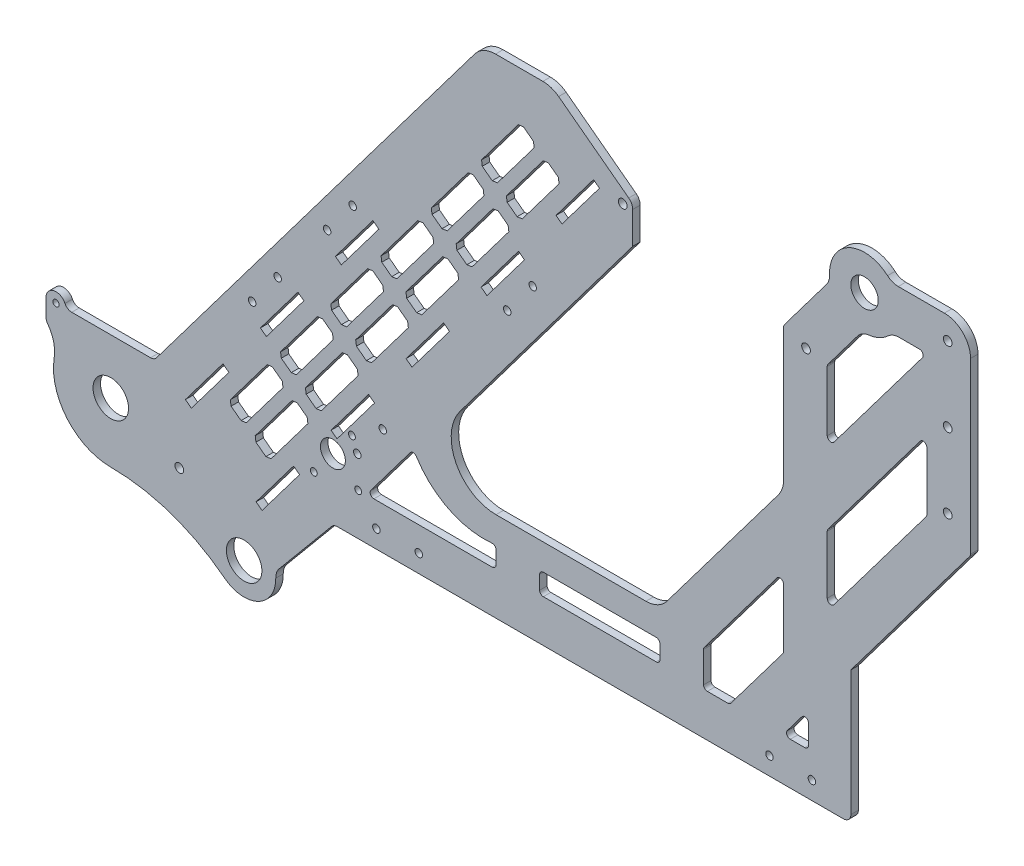
from build123d import *

# Parameters (mm, degrees)
ESBO_O1_R                 = 14.25
RESSALTO_EXTRUS_O1_DEPTH  = 6
RESSALTO_EXTRUS_O2_DEPTH  = 6
FILETE1_R                 = 12
FILETE2_R                 = 6
CORTE_EXTRUS_O1_DEPTH     = 10
FILETE3_R                 = 6
RESSALTO_EXTRUS_O3_DEPTH  = 6
ESBO_O6_R                 = 2.5
CORTE_EXTRUS_O2_DEPTH     = 10
FILETE4_R                 = 6
CORTE_EXTRUS_O3_DEPTH     = 864.46704654
ESBO_O8_R                 = 16
ESBO_O8_R_2               = 14.25
RESSALTO_EXTRUS_O4_DEPTH  = 6
CORTE_EXTRUS_O4_DEPTH     = 983.515139832
FILETE5_R                 = 55
CORTE_EXTRUS_O5_DEPTH     = 983.515139832
FILETE8_R                 = 21
RESSALTO_EXTRUS_O5_DEPTH  = 6
ESBO_O13_R                = 2.5
CORTE_EXTRUS_O7_DEPTH     = 983.515139832
CORTE_EXTRUS_O8_DEPTH     = 983.515139832
FILETE10_R                = 21
FILETE11_R                = 21
FILETE12_R                = 21
RESSALTO_EXTRUS_O6_DEPTH  = 6
FILETE13_R                = 21
CHANFRO1_SIZE             = 55
CHANFRO1_SIZE2            = 72.987465189
CORTE_EXTRUS_O10_DEPTH    = 983.515139832
FILETE15_R                = 3
RESSALTO_EXTRUS_O9_DEPTH  = 6
CORTE_EXTRUS_O12_DEPTH    = 983.515139832
FILETE16_R                = 3
ESBO_O22_W                = 96.57162865
ESBO_O22_H                = 17
CORTE_EXTRUS_O13_DEPTH    = 983.515139832
FILETE17_R                = 3
FILETE18_R                = 6
ESBO_O23_R                = 2.5
CORTE_EXTRUS_O14_DEPTH    = 983.515139832
RESSALTO_EXTRUS_O10_DEPTH = 6
FILETE19_R                = 12
ESBO_O25_R                = 10
CORTE_EXTRUS_O15_DEPTH    = 983.515139832
RESSALTO_EXTRUS_O11_DEPTH = 6
RESSALTO_EXTRUS_O12_DEPTH = 6
ESBO_O28_R                = 10
RESSALTO_EXTRUS_O13_DEPTH = 6
CORTE_EXTRUS_O16_DEPTH    = 983.515139832
ESBO_O31_R                = 3.5
CORTE_EXTRUS_O18_DEPTH    = 983.515139832
ESBO_O36_R                = 11
CORTE_EXTRUS_O21_DEPTH    = 983.515139832
ESBO_O38_R                = 3
CORTE_EXTRUS_O23_DEPTH    = 983.515139832
ESBO_O39_R                = 10
CORTE_EXTRUS_O24_DEPTH    = 983.515139832
ESBO_O40_R                = 2.75
CORTE_EXTRUS_O25_DEPTH    = 983.515139832
ESBO_O42_R                = 28
ESBO_O42_R_2              = 11
RESSALTO_EXTRUS_O16_DEPTH = 6
FILETE21_R                = 13
ESBO_O43_R                = 3.5
CORTE_EXTRUS_O27_DEPTH    = 983.515139832
ESBO_O44_R                = 16
CORTE_EXTRUS_O28_DEPTH    = 10
CORTE_EXTRUS_O29_DEPTH    = 869.729587909
ESBO_O46_R                = 3
CORTE_EXTRUS_O30_DEPTH    = 869.729587909
ESBO_O48_R                = 3.5
CORTE_EXTRUS_O31_DEPTH    = 869.729587909
CHANFRO2_SIZE             = 3


with BuildPart() as part:
    # Esboço1 → Ressalto-extrusão1 (new body)
    with BuildSketch(Plane.XY):
        with BuildLine():
            Line((0, 0), (52, 0))
            ThreePointArc((52, 0), (100.313395628, -8.084230776), (143.363260698, -31.456181952))
            ThreePointArc((143.363260698, -31.456181952), (172.156349944, -33.167061423), (183.983606557, -6.859551128))
            ThreePointArc((183.983606557, -6.859551128), (194.279022835, 32.360935307), (231, 49.560121003))
            Line((231, 49.560121003), (742, 49.560121003))
            Line((742, 49.560121003), (742, 441.560121003))
            Line((742, 441.560121003), (350.348102682, 441.560121003))
            Line((350.348102682, 441.560121003), (86.935657746, 92))
            Line((86.935657746, 92), (0, 92))
            Line((0, 92), (0, 0))
        make_face()
        with Locations((52, 48)):
            Circle(ESBO_O1_R, mode=Mode.SUBTRACT)
        with Locations((159, -11.439878997)):
            Circle(ESBO_O1_R, mode=Mode.SUBTRACT)
    extrude(amount=RESSALTO_EXTRUS_O1_DEPTH)

    # Esboço2 → Ressalto-extrusão2 (add, through all)
    with BuildSketch(Plane.XY.offset(6)):
        with BuildLine():
            Line((183.983606557, -6.859551128), (231, 49.560121003))
            ThreePointArc((231, 49.560121003), (194.279022835, 32.360935307), (183.983606557, -6.859551128))
        make_face()
    extrude(amount=-RESSALTO_EXTRUS_O2_DEPTH)

    # Filete1
    filete1_edges = [part.edges().sort_by_distance(p)[0] for p in [
        (183.983606557, -6.859551128, 3),
    ]]
    fillet(filete1_edges, radius=FILETE1_R)

    # Filete2
    filete2_edges = [part.edges().sort_by_distance(p)[0] for p in [
        (86.935657746, 92, 3),
        (231, 49.560121003, 3),
    ]]
    fillet(filete2_edges, radius=FILETE2_R)

    # Esboço3 → Corte-extrusão1 (cut)
    with BuildSketch(Plane.XY.offset(6)):
        with BuildLine():
            ThreePointArc((52, 0), (17.020473331, 16.126387664), (6.566746982, 53.198577652))
            ThreePointArc((6.566746982, 53.198577652), (5.818108209, 65.32928546), (0, 76))
            Line((0, 76), (0, 0))
            Line((0, 0), (52, 0))
        make_face()
    extrude(amount=-CORTE_EXTRUS_O1_DEPTH, mode=Mode.SUBTRACT)

    # Filete3
    filete3_edges = [part.edges().sort_by_distance(p)[0] for p in [
        (0, 76, 3),
    ]]
    fillet(filete3_edges, radius=FILETE3_R)

    # Esboço5 → Ressalto-extrusão3 (add, through all)
    with BuildSketch(Plane.XY.offset(6)):
        with BuildLine():
            Line((0, 92), (16, 92))
            ThreePointArc((16, 92), (8, 100), (0, 92))
        make_face()
    extrude(amount=-RESSALTO_EXTRUS_O3_DEPTH)

    # Esboço6 → Corte-extrusão2 (cut)
    with BuildSketch(Plane.XY.offset(6)):
        with Locations((8, 92)):
            Circle(ESBO_O6_R)
    extrude(amount=-CORTE_EXTRUS_O2_DEPTH, mode=Mode.SUBTRACT)

    # Filete4
    filete4_edges = [part.edges().sort_by_distance(p)[0] for p in [
        (16, 92, 3),
    ]]
    fillet(filete4_edges, radius=FILETE4_R)

    # Esboço7 → Corte-extrusão3 (cut, through all)
    with BuildSketch(Plane.XY.offset(6)):
        Polygon((168.599532162, 34.207607546), (198.69028332, 74.139383048), (203.48209638, 70.528492909), (173.391345223, 30.596717407), align=None)
        Polygon((228.781034478, 114.071158551), (258.871785635, 154.002934053), (263.663598695, 150.392043914), (233.572847538, 110.460268412), align=None)
        Polygon((288.962536793, 193.934709555), (319.05328795, 233.866485058), (323.845101011, 230.255594919), (293.754349853, 190.323819416), align=None)
        Polygon((349.144039108, 273.79826056), (379.234790266, 313.730036062), (384.026603326, 310.119145924), (353.935852168, 270.187370421), align=None)
        Polygon((409.325541423, 353.661811565), (439.416292581, 393.593587067), (444.208105641, 389.982696928), (414.117354483, 350.050921426), align=None)
        Polygon((111.896410949, 76.93647419), (141.987162107, 116.868249692), (146.778975167, 113.257359553), (116.688224009, 73.325584051), align=None)
        Polygon((172.077913264, 156.800025194), (202.168664422, 196.731800697), (206.960477482, 193.120910558), (176.869726324, 153.189135055), align=None)
        Polygon((232.259415579, 236.663576199), (262.350166737, 276.595351702), (267.141979797, 272.984461563), (237.05122864, 233.05268606), align=None)
    extrude(amount=-CORTE_EXTRUS_O3_DEPTH, mode=Mode.SUBTRACT)

    # Esboço9 → Corte-extrusão4 (cut, through all)
    with BuildSketch(Plane(origin=(0, 0, 0), x_dir=(-1, 0, 0), z_dir=(0, 0, -1))):
        Polygon((-592, 441.560121003), (-492, 441.560121003), (-250.862703967, 121.560121003), (-592, 121.560121003), align=None)
    extrude(amount=-CORTE_EXTRUS_O4_DEPTH, mode=Mode.SUBTRACT)

    # Filete5
    filete5_edges = [part.edges().sort_by_distance(p)[0] for p in [
        (250.862703967, 121.560121003, 3),
    ]]
    fillet(filete5_edges, radius=FILETE5_R)

    # Esboço10 → Corte-extrusão5 (cut, through all)
    with BuildSketch(Plane(origin=(0, 0, 0), x_dir=(-1, 0, 0), z_dir=(0, 0, -1))):
        with BuildLine():
            Line((-646, 49.560121003), (-742, 49.560121003))
            Line((-742, 49.560121003), (-742, 245.560121003))
            ThreePointArc((-742, 245.560121003), (-689.71858819, 217.13787766), (-646, 176.766415164))
            Line((-646, 176.766415164), (-646, 49.560121003))
        make_face()
    extrude(amount=-CORTE_EXTRUS_O5_DEPTH, mode=Mode.SUBTRACT)

    # Filete8
    filete8_edges = [part.edges().sort_by_distance(p)[0] for p in [
        (350.348102682, 441.560121003, 3),
        (742, 441.560121003, 3),
        (492, 441.560121003, 3),
    ]]
    fillet(filete8_edges, radius=FILETE8_R)

    # Esboço12 → Ressalto-extrusão5 (add, through all)
    with BuildSketch(Plane.XY.offset(6)):
        with BuildLine():
            Line((470.880516127, 420.560121003), (470.880516127, 388.554842699))
            ThreePointArc((470.880516127, 388.554842699), (467.677967693, 382.152932166), (460.634401511, 380.87662877))
            ThreePointArc((460.634401511, 380.87662877), (450.44071555, 379.947724736), (441.636873577, 374.725994882))
            Line((441.636873577, 374.725994882), (466.651861838, 407.922005517))
            ThreePointArc((466.651861838, 407.922005517), (469.795312886, 413.896723218), (470.880516127, 420.560121003))
        make_face()
    extrude(amount=-RESSALTO_EXTRUS_O5_DEPTH)

    # Esboço13 → Corte-extrusão7 (cut, through all)
    with BuildSketch(Plane.XY.offset(6)):
        with Locations((462.880516127, 388.554842699)):
            Circle(ESBO_O13_R)
    extrude(amount=-CORTE_EXTRUS_O7_DEPTH, mode=Mode.SUBTRACT)

    # Esboço14 → Corte-extrusão8 (cut, through all)
    with BuildSketch(Plane.XY.offset(6)):
        with BuildLine():
            Line((467.695036312, 394.943926779), (405.833257163, 441.560121003))
            Line((405.833257163, 441.560121003), (449.880516127, 441.560121003))
            ThreePointArc((449.880516127, 441.560121003), (464.729758531, 435.409363408), (470.880516127, 420.560121003))
            Line((470.880516127, 420.560121003), (470.880516127, 388.554842699))
            ThreePointArc((470.880516127, 388.554842699), (470.039991019, 392.124425203), (467.695036312, 394.943926779))
        make_face()
    extrude(amount=-CORTE_EXTRUS_O8_DEPTH, mode=Mode.SUBTRACT)

    # Filete10
    filete10_edges = [part.edges().sort_by_distance(p)[0] for p in [
        (405.833257163, 441.560121003, 3),
    ]]
    fillet(filete10_edges, radius=FILETE10_R)

    # Filete11
    filete11_edges = [part.edges().sort_by_distance(p)[0] for p in [
        (646, 176.766415164, 3),
    ]]
    fillet(filete11_edges, radius=FILETE11_R)

    # Filete12
    filete12_edges = [part.edges().sort_by_distance(p)[0] for p in [
        (742, 245.560121003, 3),
    ]]
    fillet(filete12_edges, radius=FILETE12_R)

    # Esboço16 → Ressalto-extrusão6 (add, through all)
    with BuildSketch(Plane.XY.offset(6)):
        Polygon((592, 254.264603165), (492, 121.560121003), (592, 121.560121003), align=None)
    extrude(amount=-RESSALTO_EXTRUS_O6_DEPTH)

    # Filete13
    filete13_edges = [part.edges().sort_by_distance(p)[0] for p in [
        (592, 254.264603165, 3),
        (492, 121.560121003, 3),
    ]]
    fillet(filete13_edges, radius=FILETE13_R)

    # Chanfro1
    chanfro1_edges = [part.edges().sort_by_distance(p)[0] for p in [
        (592, 441.560121003, 3),
    ]]
    chanfro1_side = [part.faces().sort_by_distance(p)[0] for p in [
        (656.5, 441.560121003, 3),
    ]]
    chamfer(chanfro1_edges, length=CHANFRO1_SIZE, length2=CHANFRO1_SIZE2, reference=chanfro1_side[0])

    # Esboço17 → Corte-extrusão10 (cut, through all)
    with BuildSketch(Plane.XY.offset(6)):
        Polygon((663.198220624, 406.560121003), (627, 358.523459772), (627, 300.396535273), (707, 406.560121003), align=None)
        Polygon((627, 243.900770475), (707, 350.064356205), (707, 293.568591407), (627, 187.405005677), align=None)
        Polygon((646, 106.12309249), (742, 233.519395365), (742, 283.519395365), (646, 156.12309249), align=None)
    extrude(amount=-CORTE_EXTRUS_O10_DEPTH, mode=Mode.SUBTRACT)

    # Filete15
    filete15_edges = [part.edges().sort_by_distance(p)[0] for p in [
        (592, 368.572655814, 3),
        (647, 441.560121003, 3),
        (627, 187.405005677, 3),
        (627, 243.900770475, 3),
        (707, 350.064356205, 3),
        (707, 293.568591407, 3),
        (742, 283.519395365, 3),
        (663.198220624, 406.560121003, 3),
        (707, 406.560121003, 3),
        (627, 300.396535273, 3),
        (627, 358.523459772, 3),
    ]]
    fillet(filete15_edges, radius=FILETE15_R)

    # Esboço20 → Ressalto-extrusão9 (add, through all)
    with BuildSketch(Plane.XY.offset(6)):
        Polygon((694.488580605, 220.46961229), (646, 156.12309249), (646, 192.12309249), align=None)
    extrude(amount=-RESSALTO_EXTRUS_O9_DEPTH)

    # Esboço21 → Corte-extrusão12 (cut, through all)
    with BuildSketch(Plane.XY.offset(6)):
        Polygon((592, 197.454201718), (527.747266571, 112.187944547), (527.747266571, 83.560121003), (548.747266571, 83.560121003), (592, 140.95843692), align=None)
        Polygon((591.319878949, 83.560121003), (612, 83.560121003), (612, 111.003568554), align=None)
    extrude(amount=-CORTE_EXTRUS_O12_DEPTH, mode=Mode.SUBTRACT)

    # Filete16
    filete16_edges = [part.edges().sort_by_distance(p)[0] for p in [
        (591.319878949, 83.560121003, 3),
        (612, 111.003568554, 3),
        (612, 83.560121003, 3),
        (592, 197.454201718, 3),
        (592, 140.95843692, 3),
        (548.747266571, 83.560121003, 3),
        (527.747266571, 83.560121003, 3),
        (527.747266571, 112.187944547, 3),
    ]]
    fillet(filete16_edges, radius=FILETE16_R)

    # Esboço22 → Corte-extrusão13 (cut, through all)
    with BuildSketch(Plane.XY.offset(6)):
        with BuildLine():
            Line((295.041227004, 133.874158136), (257.126880545, 83.560121003))
            Line((257.126880545, 83.560121003), (361.175637921, 83.560121003))
            Line((361.175637921, 83.560121003), (361.175637921, 100.560121003))
            ThreePointArc((361.175637921, 100.560121003), (322.80100567, 106.680933974), (295.041227004, 133.874158136))
        make_face()
        with Locations((444.461452246, 92.060121003)):
            Rectangle(ESBO_O22_W, ESBO_O22_H)
    extrude(amount=-CORTE_EXTRUS_O13_DEPTH, mode=Mode.SUBTRACT)

    # Filete17
    filete17_edges = [part.edges().sort_by_distance(p)[0] for p in [
        (295.041227004, 133.874158136, 3),
        (361.175637921, 100.560121003, 3),
        (361.175637921, 83.560121003, 3),
        (257.126880545, 83.560121003, 3),
        (396.175637921, 100.560121003, 3),
        (492.747266571, 100.560121003, 3),
        (492.747266571, 83.560121003, 3),
        (396.175637921, 83.560121003, 3),
    ]]
    fillet(filete17_edges, radius=FILETE17_R)

    # Filete18
    filete18_edges = [part.edges().sort_by_distance(p)[0] for p in [
        (646, 49.560121003, 3),
    ]]
    fillet(filete18_edges, radius=FILETE18_R)

    # Esboço23 → Corte-extrusão14 (cut, through all)
    with BuildSketch(Plane.XY.offset(6)):
        with Locations((610, 361.560121003)):
            Circle(ESBO_O23_R)
    extrude(amount=-CORTE_EXTRUS_O14_DEPTH, mode=Mode.SUBTRACT)

    # Esboço24 → Ressalto-extrusão10 (add, through all)
    with BuildSketch(Plane(origin=(0, 0, 0), x_dir=(-1, 0, 0), z_dir=(0, 0, -1))):
        with BuildLine():
            Line((-133.242554324, 153.451327309), (-98.077124114, 106.785225249))
            ThreePointArc((-98.077124114, 106.785225249), (-100.417464173, 141.604229728), (-133.242554324, 153.451327309))
        make_face()
    extrude(amount=-RESSALTO_EXTRUS_O10_DEPTH)

    # Filete19
    filete19_edges = [part.edges().sort_by_distance(p)[0] for p in [
        (133.242554324, 153.451327309, 3),
        (98.077124114, 106.785225249, 3),
    ]]
    fillet(filete19_edges, radius=FILETE19_R)

    # Esboço25 → Corte-extrusão15 (cut, through all)
    with BuildSketch(Plane.XY.offset(6)):
        with Locations((125.897786796, 122.403429417)):
            Circle(ESBO_O25_R)
    extrude(amount=-CORTE_EXTRUS_O15_DEPTH, mode=Mode.SUBTRACT)

    # Esboço26 → Ressalto-extrusão11 (add)
    with BuildSketch(Plane.XY.offset(6)):
        with BuildLine():
            Line((311.954248033, 152.019241282), (470.880516127, 362.921522375))
            Line((470.880516127, 362.921522375), (470.880516127, 388.554842699))
            ThreePointArc((470.880516127, 388.554842699), (467.677967693, 382.152932166), (460.634401511, 380.87662877))
            ThreePointArc((460.634401511, 380.87662877), (450.44071555, 379.947724736), (441.636873577, 374.725994882))
            Line((441.636873577, 374.725994882), (317.250684869, 209.659947276))
            ThreePointArc((317.250684869, 209.659947276), (306.406366905, 181.592710029), (311.954248033, 152.019241282))
        make_face()
    extrude(amount=-RESSALTO_EXTRUS_O11_DEPTH)

    # Esboço27 → Ressalto-extrusão12 (add)
    with BuildSketch(Plane.XY.offset(6)):
        with BuildLine():
            Line((332.437042037, 179.200826997), (311.954248033, 152.019241282))
            ThreePointArc((311.954248033, 152.019241282), (332.23387212, 129.790748628), (361.175637921, 121.560121003))
            ThreePointArc((361.175637921, 121.560121003), (328.971764393, 141.488482625), (332.437042037, 179.200826997))
        make_face()
    extrude(amount=-RESSALTO_EXTRUS_O12_DEPTH)

    # Esboço28 → Ressalto-extrusão13 (add, through all)
    with BuildSketch(Plane.XY.offset(6)):
        with Locations((125.897786796, 122.403429417)):
            Circle(ESBO_O28_R)
        with BuildLine():
            Line((93.864198952, 101.194484729), (137.455479486, 159.042067829))
            ThreePointArc((137.455479486, 159.042067829), (96.038333321, 144.904141517), (93.864198952, 101.194484729))
        make_face()
    extrude(amount=-RESSALTO_EXTRUS_O13_DEPTH)

    # Esboço29 → Corte-extrusão16 (cut, through all)
    with BuildSketch(Plane.XY.offset(6)):
        with BuildLine():
            Line((93.864198952, 101.194484729), (137.455479486, 159.042067829))
            ThreePointArc((137.455479486, 159.042067829), (96.038333321, 144.904141517), (93.864198952, 101.194484729))
        make_face()
    extrude(amount=-CORTE_EXTRUS_O16_DEPTH, mode=Mode.SUBTRACT)

    # Esboço31 → Corte-extrusão18 (cut, through all)
    with BuildSketch(Plane.XY.offset(6)):
        with Locations((462.880516127, 388.554842699)):
            Circle(ESBO_O31_R)
        with Locations((610, 361.560121003)):
            Circle(ESBO_O31_R)
    extrude(amount=-CORTE_EXTRUS_O18_DEPTH, mode=Mode.SUBTRACT)

    # Esboço36 → Corte-extrusão21 (cut, through all)
    with BuildSketch(Plane.XY.offset(6)):
        with Locations((656.91742051, 423.764426342)):
            Circle(ESBO_O36_R)
    extrude(amount=-CORTE_EXTRUS_O21_DEPTH, mode=Mode.SUBTRACT)

    # Esboço38 → Corte-extrusão23 (cut, through all)
    with BuildSketch(Plane.XY.offset(6)):
        with Locations((580.6625, 63.860121003)):
            Circle(ESBO_O38_R)
        with Locations((614.6625, 63.860121003)):
            Circle(ESBO_O38_R)
        with Locations((265.1625, 63.860121003)):
            Circle(ESBO_O38_R)
        with Locations((299.1625, 63.860121003)):
            Circle(ESBO_O38_R)
    extrude(amount=-CORTE_EXTRUS_O23_DEPTH, mode=Mode.SUBTRACT)

    # Esboço39 → Corte-extrusão24 (cut, through all)
    with BuildSketch(Plane.XY.offset(6)):
        with Locations((230.246169041, 98.491842526)):
            Circle(ESBO_O39_R)
    extrude(amount=-CORTE_EXTRUS_O24_DEPTH, mode=Mode.SUBTRACT)

    # Esboço40 → Corte-extrusão25 (cut, through all)
    with BuildSketch(Plane.XY.offset(6)):
        with Locations((245.532270629, 118.777184481)):
            Circle(ESBO_O40_R)
        with Locations((250.531510997, 83.205740937)):
            Circle(ESBO_O40_R)
        with Locations((214.960067453, 78.20650057)):
            Circle(ESBO_O40_R)
    extrude(amount=-CORTE_EXTRUS_O25_DEPTH, mode=Mode.SUBTRACT)

    # Esboço42 → Ressalto-extrusão16 (add, through all)
    with BuildSketch(Plane(origin=(0, 0, 0), x_dir=(-1, 0, 0), z_dir=(0, 0, -1))):
        with Locations((-656.91742051, 423.764426342)):
            Circle(ESBO_O42_R)
        with Locations(Location((-656.91742051, 423.764426342, 0), (0, 0, 180))):
            Circle(ESBO_O42_R_2, mode=Mode.SUBTRACT)
    extrude(amount=-RESSALTO_EXTRUS_O16_DEPTH)

    # Filete21
    filete21_edges = [part.edges().sort_by_distance(p)[0] for p in [
        (655.10722132, 395.823002275, 3),
        (629.459247101, 418.282755701, 3),
        (678.534849857, 441.560121003, 3),
        (679.008411384, 406.560121003, 3),
    ]]
    fillet(filete21_edges, radius=FILETE21_R)

    # Esboço43 → Corte-extrusão27 (cut, through all)
    with BuildSketch(Plane.XY.offset(6)):
        with Locations((723.7, 423.586279348)):
            Circle(ESBO_O43_R)
        with Locations((723.7, 363.586279348)):
            Circle(ESBO_O43_R)
        with Locations((723.7, 303.586279348)):
            Circle(ESBO_O43_R)
    extrude(amount=-CORTE_EXTRUS_O27_DEPTH, mode=Mode.SUBTRACT)

    # Esboço45 → Corte-extrusão29 (cut, through all)
    with BuildSketch(Plane.XY.offset(6)):
        Polygon((237.7136214, 172.451025721), (206.419240196, 130.921979199), (219.197408357, 121.292938828), (250.491789561, 162.821985351), (249.9013281, 167.02333695), (241.914973, 173.041487182), align=None)
        Polygon((228.580404066, 201.871840481), (258.0693402, 241.004980473), (262.2706918, 241.595441934), (270.2570469, 235.577291702), (270.847508361, 231.375940103), (241.358572226, 192.242800111), (237.157220627, 191.65233865), (229.170865526, 197.670488881), align=None)
        Polygon((278.035227951, 225.959604894), (246.740846747, 184.430558372), (259.519014908, 174.801518002), (290.813396112, 216.330564524), (290.222934651, 220.531916124), (282.236579551, 226.550066355), align=None)
        Polygon((318.356834503, 279.468184068), (287.062453299, 237.939137545), (299.840621459, 228.310097175), (331.135002663, 269.839143697), (330.544541203, 274.040495297), (322.558186102, 280.058645528), align=None)
        Polygon((358.678441054, 332.976763241), (327.38405985, 291.447716718), (340.162228011, 281.818676348), (371.456609214, 323.34772287), (370.866147754, 327.54907447), (362.879792653, 333.567224702), align=None)
        Polygon((349.545223719, 362.397578), (379.034159854, 401.530717993), (383.235511453, 402.121179453), (391.221866554, 396.103029222), (391.812328014, 391.901677622), (362.32339188, 352.76853763), (358.12204028, 352.178076169), (350.13568518, 358.196226401), align=None)
        Polygon((399.000047605, 386.485342414), (367.705666401, 344.956295892), (380.483834562, 335.327255521), (411.778215766, 376.856302044), (411.187754305, 381.057653643), (403.201399204, 387.075803875), align=None)
        Polygon((188.258797515, 148.363261308), (217.747733649, 187.4964013), (221.949085249, 188.086862761), (229.935440349, 182.068712529), (230.52590181, 177.86736093), (201.036965675, 138.734220937), (196.835614076, 138.143759477), (188.849258975, 144.161909708), align=None)
        Polygon((268.902010617, 255.380419654), (298.390946751, 294.513559646), (302.592298351, 295.104021107), (310.578653451, 289.085870876), (311.169114912, 284.884519276), (281.680178778, 245.751379284), (277.478827178, 245.160917823), (269.492472078, 251.179068055), align=None)
        Polygon((309.223617168, 308.888998827), (338.712553303, 348.02213882), (342.913904902, 348.61260028), (350.900260003, 342.594450049), (351.490721463, 338.393098449), (322.001785329, 299.259958457), (317.800433729, 298.669496996), (309.814078629, 304.687647228), align=None)
        Polygon((147.937190963, 94.854682135), (177.426127098, 133.987822127), (181.627478697, 134.578283588), (189.613833798, 128.560133356), (190.204295259, 124.358781757), (160.715359124, 85.225641764), (156.514007524, 84.635180304), (148.527652424, 90.653330535), align=None)
        Polygon((197.392014849, 118.942446548), (166.097633645, 77.413400026), (178.875801806, 67.784359655), (210.17018301, 109.313406178), (209.579721549, 113.514757777), (201.593366449, 119.532908009), align=None)
    extrude(amount=-CORTE_EXTRUS_O29_DEPTH, mode=Mode.SUBTRACT)

    # Esboço46 → Corte-extrusão30 (cut, through all)
    with BuildSketch(Plane.XY.offset(6)):
        with Locations((390.632570934, 295.124107012)):
            Circle(ESBO_O46_R)
        with Locations((370.170860147, 267.97049967)):
            Circle(ESBO_O46_R)
        with Locations((249.807855517, 108.243397661)):
            Circle(ESBO_O46_R)
        with Locations((270.269566304, 135.397005003)):
            Circle(ESBO_O46_R)
        with Locations((165.471945656, 171.795064106)):
            Circle(ESBO_O46_R)
        with Locations((185.933656443, 198.948671447)):
            Circle(ESBO_O46_R)
        with Locations((225.653447971, 251.658615111)):
            Circle(ESBO_O46_R)
        with Locations((246.115158758, 278.812222452)):
            Circle(ESBO_O46_R)
    extrude(amount=-CORTE_EXTRUS_O30_DEPTH, mode=Mode.SUBTRACT)

    # Esboço48 → Corte-extrusão31 (cut, through all)
    with BuildSketch(Plane.XY.offset(6)):
        with Locations((107, 27)):
            Circle(ESBO_O48_R)
    extrude(amount=-CORTE_EXTRUS_O31_DEPTH, mode=Mode.SUBTRACT)

    # Chanfro2
    chanfro2_edges = [part.edges().sort_by_distance(p)[0] for p in [
        (287.062453299, 237.939137545, 3),
        (299.840621459, 228.310097175, 3),
        (166.097633645, 77.413400026, 3),
        (178.875801806, 67.784359655, 3),
        (219.197408357, 121.292938828, 3),
        (206.419240196, 130.921979199, 3),
        (246.740846747, 184.430558372, 3),
        (259.519014908, 174.801518002, 3),
        (327.38405985, 291.447716718, 3),
        (340.162228011, 281.818676348, 3),
        (367.705666401, 344.956295892, 3),
        (380.483834562, 335.327255521, 3),
    ]]
    chamfer(chanfro2_edges, length=CHANFRO2_SIZE)


with BuildPart() as body_2:
    # Esboço8 → Ressalto-extrusão4 (new body)
    with BuildSketch(Plane.XY.offset(6)):
        with Locations((711, 628)):
            Circle(ESBO_O8_R)
        with Locations((711, 628)):
            Circle(ESBO_O8_R_2, mode=Mode.SUBTRACT)
    extrude(amount=-RESSALTO_EXTRUS_O4_DEPTH)

    # Esboço44 → Corte-extrusão28 (cut)
    with BuildSketch(Plane.XY.offset(6)):
        with Locations((711, 628)):
            Circle(ESBO_O44_R)
    extrude(amount=-CORTE_EXTRUS_O28_DEPTH, mode=Mode.SUBTRACT)


solid = part.part
